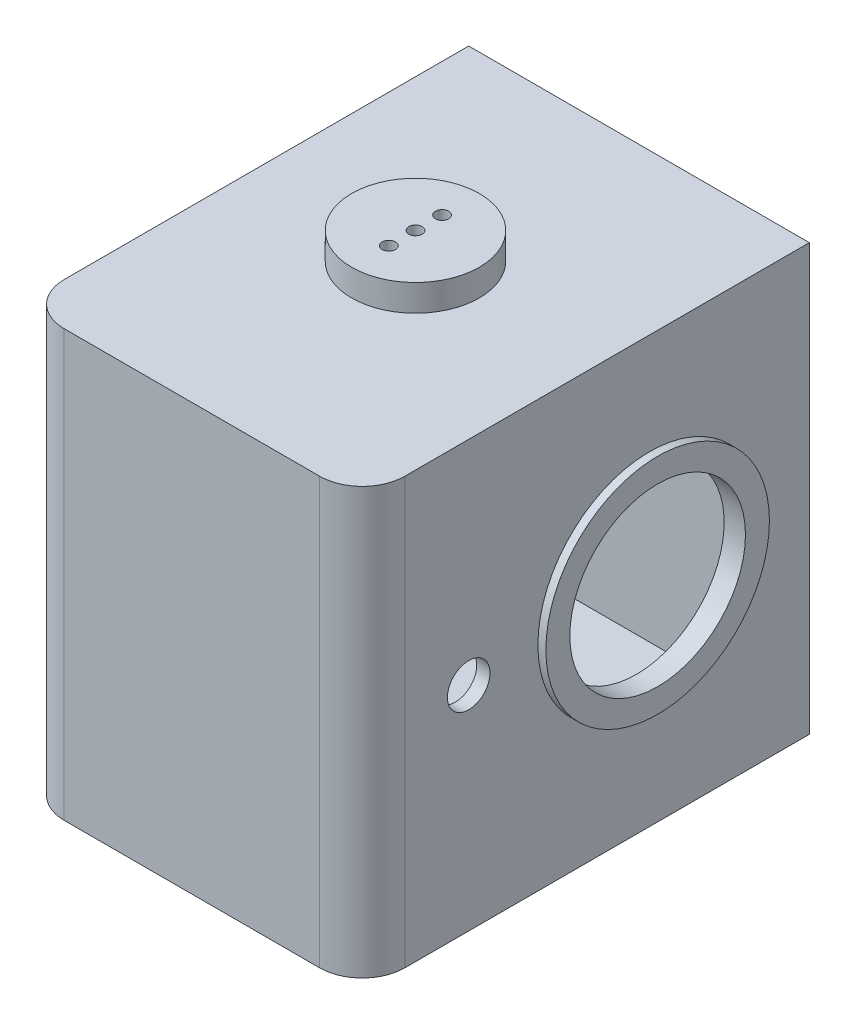
from build123d import *

# Parameters (mm, degrees)
S_BOX1_W       = 64
S_BOX1_H       = 80
BOSS_1_DEPTH   = 76
S_BOX2_W       = 48
S_BOX2_H       = 80
BOSS_2_DEPTH   = 8.1
S_CYL3_R       = 8
BOSS_3_DEPTH   = 80
S_CYL4_R       = 8
BOSS_4_DEPTH   = 80
S_CYL5_R       = 21
BOSS_5_DEPTH   = 1.6
S_CYL6_R       = 12
BOSS_6_DEPTH   = 5.1
S_CYL7_R       = 12
BOSS_7_DEPTH   = 5.1
S_CUT8_W       = 62.5
S_CUT8_H       = 75
POCKET_8_DEPTH = 73.5
S_CUT9_W       = 48
S_CUT9_H       = 75
POCKET_9_DEPTH = 5.6
S_HOLE10_R     = 5.5
HOLE_10_DEPTH  = 75
S_HOLE11_R     = 5.5
HOLE_11_DEPTH  = 75
S_HOLE12_R     = 16.5
HOLE_12_DEPTH  = 4.2
S_HOLE13_R     = 4
HOLE_13_DEPTH  = 2.7
S_HOLE14_R     = 1.5
HOLE_14_DEPTH  = 2.7
S_HOLE15_R     = 0.8
HOLE_15_DEPTH  = 2.7
S_HOLE16_R     = 0.8
HOLE_16_DEPTH  = 2.7
S_HOLE17_R     = 1.25
HOLE_17_DEPTH  = 7.7
S_HOLE18_R     = 1.25
HOLE_18_DEPTH  = 7.7
S_HOLE19_R     = 1.25
HOLE_19_DEPTH  = 7.7
S_HOLE20_R     = 1.25
HOLE_20_DEPTH  = 7.7
S_HOLE21_R     = 1.25
HOLE_21_DEPTH  = 7.7
S_HOLE22_R     = 1.25
HOLE_22_DEPTH  = 7.7


with BuildPart() as part:
    # S_box1 → Boss_1 (new body)
    with BuildSketch(Plane.XY):
        Rectangle(S_BOX1_W, S_BOX1_H)
    extrude(amount=BOSS_1_DEPTH)

    # S_box2 → Boss_2 (add)
    with BuildSketch(Plane.XY.offset(75.9)):
        Rectangle(S_BOX2_W, S_BOX2_H)
    extrude(amount=BOSS_2_DEPTH)

    # S_cyl3 → Boss_3 (add)
    with BuildSketch(Plane(origin=(0, -40, 0), x_dir=(1, 0, 0), z_dir=(0, 1, 0))):
        with Locations((-24, -76)):
            Circle(S_CYL3_R)
    extrude(amount=BOSS_3_DEPTH)

    # S_cyl4 → Boss_4 (add)
    with BuildSketch(Plane(origin=(0, -40, 0), x_dir=(1, 0, 0), z_dir=(0, 1, 0))):
        with Locations((24, -76)):
            Circle(S_CYL4_R)
    extrude(amount=BOSS_4_DEPTH)

    # S_cyl5 → Boss_5 (add)
    with BuildSketch(Plane(origin=(31.9, 0, 0), x_dir=(0, 0, -1), z_dir=(1, 0, 0))):
        with Locations((-30, 0)):
            Circle(S_CYL5_R)
    extrude(amount=BOSS_5_DEPTH)

    # S_cyl6 → Boss_6 (add)
    with BuildSketch(Plane(origin=(0, 39.9, 0), x_dir=(1, 0, 0), z_dir=(0, 1, 0))):
        with Locations((-2, -40)):
            Circle(S_CYL6_R)
    extrude(amount=BOSS_6_DEPTH)

    # S_cyl7 → Boss_7 (add)
    with BuildSketch(Plane(origin=(0, -45, 0), x_dir=(1, 0, 0), z_dir=(0, 1, 0))):
        with Locations((-2, -40)):
            Circle(S_CYL7_R)
    extrude(amount=BOSS_7_DEPTH)

    # S_cut8 → Pocket_8 (cut)
    with BuildSketch(Plane.XY.offset(2.5)):
        with Locations((-1.75, 0)):
            Rectangle(S_CUT8_W, S_CUT8_H)
    extrude(amount=POCKET_8_DEPTH, mode=Mode.SUBTRACT)

    # S_cut9 → Pocket_9 (cut)
    with BuildSketch(Plane.XY.offset(75.9)):
        Rectangle(S_CUT9_W, S_CUT9_H)
    extrude(amount=POCKET_9_DEPTH, mode=Mode.SUBTRACT)

    # S_hole10 → Hole_10 (cut)
    with BuildSketch(Plane(origin=(0, -37.5, 0), x_dir=(1, 0, 0), z_dir=(0, 1, 0))):
        with Locations((-24, -76)):
            Circle(S_HOLE10_R)
    extrude(amount=HOLE_10_DEPTH, mode=Mode.SUBTRACT)

    # S_hole11 → Hole_11 (cut)
    with BuildSketch(Plane(origin=(0, -37.5, 0), x_dir=(1, 0, 0), z_dir=(0, 1, 0))):
        with Locations((24, -76)):
            Circle(S_HOLE11_R)
    extrude(amount=HOLE_11_DEPTH, mode=Mode.SUBTRACT)

    # S_hole12 → Hole_12 (cut)
    with BuildSketch(Plane(origin=(29.4, 0, 0), x_dir=(0, 0, -1), z_dir=(1, 0, 0))):
        with Locations((-30, 0)):
            Circle(S_HOLE12_R)
    extrude(amount=HOLE_12_DEPTH, mode=Mode.SUBTRACT)

    # S_hole13 → Hole_13 (cut)
    with BuildSketch(Plane(origin=(29.4, 0, 0), x_dir=(0, 0, -1), z_dir=(1, 0, 0))):
        with Locations((-64, 0)):
            Circle(S_HOLE13_R)
    extrude(amount=HOLE_13_DEPTH, mode=Mode.SUBTRACT)

    # S_hole14 → Hole_14 (cut)
    with BuildSketch(Plane.XY.offset(-0.1)):
        Circle(S_HOLE14_R)
    extrude(amount=HOLE_14_DEPTH, mode=Mode.SUBTRACT)

    # S_hole15 → Hole_15 (cut)
    with BuildSketch(Plane.XY.offset(-0.1)):
        with Locations((0, 7)):
            Circle(S_HOLE15_R)
    extrude(amount=HOLE_15_DEPTH, mode=Mode.SUBTRACT)

    # S_hole16 → Hole_16 (cut)
    with BuildSketch(Plane.XY.offset(-0.1)):
        with Locations((0, -7)):
            Circle(S_HOLE16_R)
    extrude(amount=HOLE_16_DEPTH, mode=Mode.SUBTRACT)

    # S_hole17 → Hole_17 (cut)
    with BuildSketch(Plane(origin=(0, 37.4, 0), x_dir=(1, 0, 0), z_dir=(0, 1, 0))):
        with Locations((-2, -35)):
            Circle(S_HOLE17_R)
    extrude(amount=HOLE_17_DEPTH, mode=Mode.SUBTRACT)

    # S_hole18 → Hole_18 (cut)
    with BuildSketch(Plane(origin=(0, -45.1, 0), x_dir=(1, 0, 0), z_dir=(0, 1, 0))):
        with Locations((-2, -35)):
            Circle(S_HOLE18_R)
    extrude(amount=HOLE_18_DEPTH, mode=Mode.SUBTRACT)

    # S_hole19 → Hole_19 (cut)
    with BuildSketch(Plane(origin=(0, 37.4, 0), x_dir=(1, 0, 0), z_dir=(0, 1, 0))):
        with Locations((-2, -40)):
            Circle(S_HOLE19_R)
    extrude(amount=HOLE_19_DEPTH, mode=Mode.SUBTRACT)

    # S_hole20 → Hole_20 (cut)
    with BuildSketch(Plane(origin=(0, -45.1, 0), x_dir=(1, 0, 0), z_dir=(0, 1, 0))):
        with Locations((-2, -40)):
            Circle(S_HOLE20_R)
    extrude(amount=HOLE_20_DEPTH, mode=Mode.SUBTRACT)

    # S_hole21 → Hole_21 (cut)
    with BuildSketch(Plane(origin=(0, 37.4, 0), x_dir=(1, 0, 0), z_dir=(0, 1, 0))):
        with Locations((-2, -45)):
            Circle(S_HOLE21_R)
    extrude(amount=HOLE_21_DEPTH, mode=Mode.SUBTRACT)

    # S_hole22 → Hole_22 (cut)
    with BuildSketch(Plane(origin=(0, -45.1, 0), x_dir=(1, 0, 0), z_dir=(0, 1, 0))):
        with Locations((-2, -45)):
            Circle(S_HOLE22_R)
    extrude(amount=HOLE_22_DEPTH, mode=Mode.SUBTRACT)


solid = part.part
